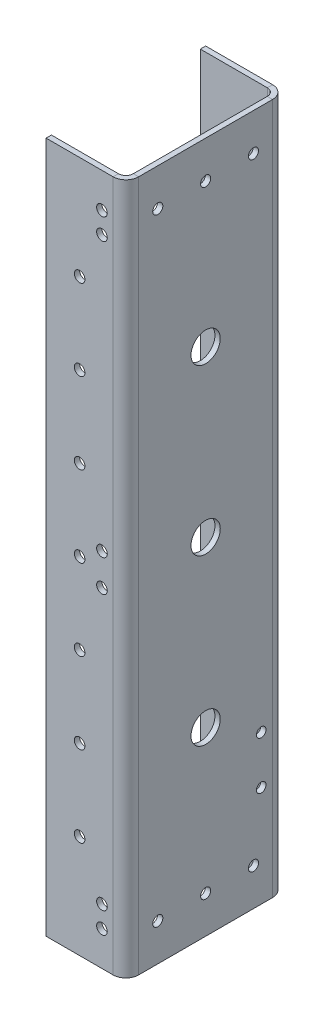
from build123d import *

# Parameters (mm, degrees)
SKETCH1_W                      = 300
SKETCH1_H                      = 1300
BASE_FLANGE1_DEPTH             = 10
EDGE_FLANGE1_STRIP_W           = 68
EDGE_FLANGE1_STRIP_H           = 10
EDGE_FLANGE1_STRIP_CUT_DEPTH   = 1300
EDGE_FLANGE1_STRIP_2_W         = 68
EDGE_FLANGE1_STRIP_2_H         = 10
EDGE_FLANGE1_STRIP_CUT_2_DEPTH = 1300
EDGE_FLANGE1_DEPTH             = 1300
EDGE_FLANGE1_BEND_DEPTH        = 1300
SKETCH12_R                     = 9.5
CUT_EXTRUDE1_DEPTH             = 10
MIRROR2_COPY_1_SKETCH_R        = 9.5
MIRROR2_COPY_1_DEPTH           = 10
SKETCH13_R                     = 27.5
CUT_EXTRUDE2_DEPTH             = 10
LPATTERN1_COUNT                = 3
LPATTERN1_PITCH                = 310
SKETCH14_R                     = 10
CUT_EXTRUDE3_DEPTH             = 732.436941916
LPATTERN2_COUNT                = 7
LPATTERN2_PITCH                = 152
SKETCH18_R                     = 10
CUT_EXTRUDE4_DEPTH             = 732.436941916
SKETCH20_R                     = 9
CUT_EXTRUDE5_DEPTH             = 10


# Sheet-metal steps are written as plain solids
with BuildPart() as part:
    # Sketch1 → Base-Flange1 (new body)
    with BuildSketch(Plane(origin=(0, 0, 0), x_dir=(0, 0, -1), z_dir=(1, 0, 0))):
        Rectangle(SKETCH1_W, SKETCH1_H)
    extrude(amount=-BASE_FLANGE1_DEPTH)

    # Edge-Flange1 strip (across the edge) → Edge-Flange1 strip cut (cut)
    with BuildSketch(Plane(origin=(-10, -650, 150), x_dir=(0, 0, -1), z_dir=(0, 1, 0))):
        with Locations((-10, -5)):
            Rectangle(EDGE_FLANGE1_STRIP_W, EDGE_FLANGE1_STRIP_H)
    extrude(amount=EDGE_FLANGE1_STRIP_CUT_DEPTH, mode=Mode.SUBTRACT)

    # Edge-Flange1 strip 2 (across the edge) → Edge-Flange1 strip cut 2 (cut)
    with BuildSketch(Plane(origin=(-10, 650, -150), x_dir=(0, 0, 1), z_dir=(0, -1, 0))):
        with Locations((-10, -5)):
            Rectangle(EDGE_FLANGE1_STRIP_2_W, EDGE_FLANGE1_STRIP_2_H)
    extrude(amount=EDGE_FLANGE1_STRIP_CUT_2_DEPTH, mode=Mode.SUBTRACT)

    # Edge-Flange1 section (across the edge) → Edge-Flange1 (add)
    with BuildSketch(Plane(origin=(-10, -650, 150), x_dir=(0, 0, -1), z_dir=(0, 1, 0))):
        with BuildLine():
            Line((0, 14), (0, 140))
            Line((0, 140), (10, 140))
            Line((10, 140), (10, 14))
            ThreePointArc((10, 14), (14.100505063, 4.100505063), (24, 0))
            Line((24, 0), (24, -10))
            ThreePointArc((24, -10), (7.029437252, -2.970562748), (0, 14))
        make_face()
    extrude(amount=EDGE_FLANGE1_DEPTH)

    # Edge-Flange1 section 2 (across the edge) → Edge-Flange1 bend (add)
    with BuildSketch(Plane(origin=(-10, 650, -150), x_dir=(0, 0, 1), z_dir=(0, -1, 0))):
        with BuildLine():
            Line((0, 14), (0, 140))
            Line((0, 140), (10, 140))
            Line((10, 140), (10, 14))
            ThreePointArc((10, 14), (14.100505063, 4.100505063), (24, 0))
            Line((24, 0), (24, -10))
            ThreePointArc((24, -10), (7.029437252, -2.970562748), (0, 14))
        make_face()
    extrude(amount=EDGE_FLANGE1_BEND_DEPTH)

    # Sketch12 → Cut-Extrude1 (cut)
    with BuildSketch(Plane(origin=(0, 0, 0), x_dir=(0, 0, -1), z_dir=(1, 0, 0))):
        with Locations((90, 580)):
            Circle(SKETCH12_R)
        with Locations((0, 580)):
            Circle(SKETCH12_R)
    cut_extrude1 = extrude(amount=-CUT_EXTRUDE1_DEPTH, mode=Mode.SUBTRACT)

    # Mirror1: Cut-Extrude1 across plane
    add(cut_extrude1.mirror(Plane.ZX), mode=Mode.SUBTRACT)

    # Mirror2: Cut-Extrude1 across plane
    add(cut_extrude1.mirror(Plane.XY), mode=Mode.SUBTRACT)

    # Mirror2 copy 1 sketch → Mirror2 copy 1 (cut)
    with BuildSketch(Plane(origin=(0, 0, 0), x_dir=(0, 0, 1), z_dir=(1, 0, 0))):
        with Locations((90, 580)):
            Circle(MIRROR2_COPY_1_SKETCH_R)
        with Locations((0, 580)):
            Circle(MIRROR2_COPY_1_SKETCH_R)
    extrude(amount=-MIRROR2_COPY_1_DEPTH, mode=Mode.SUBTRACT)

    # Sketch13 → Cut-Extrude2 (cut)
    with BuildSketch(Plane(origin=(0, 0, 0), x_dir=(0, 0, -1), z_dir=(1, 0, 0))):
        with Locations((0, 310)):
            Circle(SKETCH13_R)
    cut_extrude2 = extrude(amount=-CUT_EXTRUDE2_DEPTH, mode=Mode.SUBTRACT)

    # LPattern1: Cut-Extrude2 ×3
    with Locations(*[(0, -i * LPATTERN1_PITCH, 0) for i in range(1, LPATTERN1_COUNT)]):
        add(cut_extrude2, mode=Mode.SUBTRACT)

    # Sketch14 → Cut-Extrude3 (cut, through all)
    with BuildSketch(Plane(origin=(0, 0, -150), x_dir=(-1, 0, 0), z_dir=(0, 0, -1))):
        with Locations((87, -456)):
            Circle(SKETCH14_R)
    cut_extrude3 = extrude(amount=-CUT_EXTRUDE3_DEPTH, mode=Mode.SUBTRACT)

    # LPattern2: Cut-Extrude3 ×7
    with Locations(*[(0, i * LPATTERN2_PITCH, 0) for i in range(1, LPATTERN2_COUNT)]):
        add(cut_extrude3, mode=Mode.SUBTRACT)

    # Sketch18 → Cut-Extrude4 (cut, through all)
    with BuildSketch(Plane(origin=(0, 0, -150), x_dir=(-1, 0, 0), z_dir=(0, 0, -1))):
        with Locations((45, 545)):
            Circle(SKETCH18_R)
        with Locations((45, 585)):
            Circle(SKETCH18_R)
        with Locations((45, 30)):
            Circle(SKETCH18_R)
    cut_extrude4 = extrude(amount=-CUT_EXTRUDE4_DEPTH, mode=Mode.SUBTRACT)

    # Mirror3: Cut-Extrude4 across plane
    add(cut_extrude4.mirror(Plane.ZX), mode=Mode.SUBTRACT)

    # Sketch20 → Cut-Extrude5 (cut)
    with BuildSketch(Plane(origin=(0, 0, 0), x_dir=(0, 0, -1), z_dir=(1, 0, 0))):
        with Locations((104.55, -370)):
            Circle(SKETCH20_R)
        with Locations((104.55, -460)):
            Circle(SKETCH20_R)
    extrude(amount=-CUT_EXTRUDE5_DEPTH, mode=Mode.SUBTRACT)


solid = part.part
